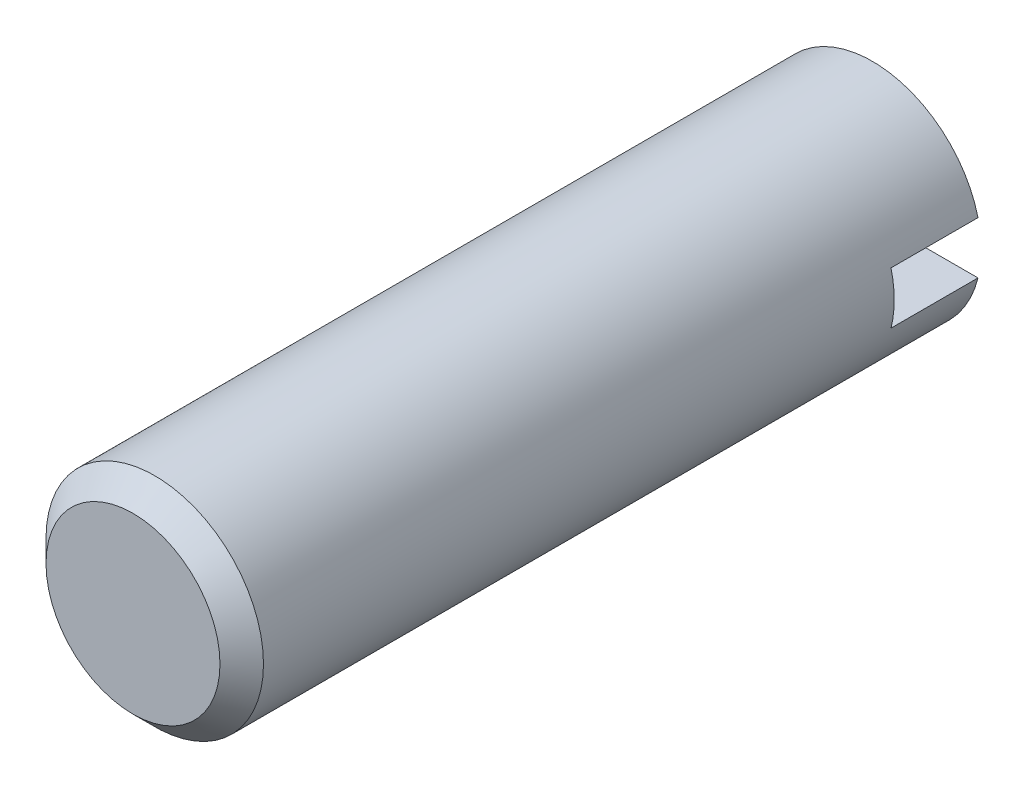
from build123d import *

# Parameters (mm, degrees)
SKETCH2_W          = 5.424806346
SKETCH2_H          = 1.2
CUT_EXTRUDE1_DEPTH = 2


with BuildPart() as part:
    # Sketch1 → Revolve1 (revolve)
    with BuildSketch(Plane(origin=(0, 0, 0), x_dir=(0, 0, -1), z_dir=(1, 0, 0))):
        Polygon((0, 0), (0, 2), (0.5, 2.5), (17, 2.5), (17, 0), align=None)
    revolve(axis=Axis((0, 0, 0), (0, 0, -1)))

    # Sketch2 → Cut-Extrude1 (cut)
    with BuildSketch(Plane(origin=(0, 0, -17), x_dir=(-1, 0, 0), z_dir=(0, 0, -1))):
        Rectangle(SKETCH2_W, SKETCH2_H)
    extrude(amount=-CUT_EXTRUDE1_DEPTH, mode=Mode.SUBTRACT)


solid = part.part
